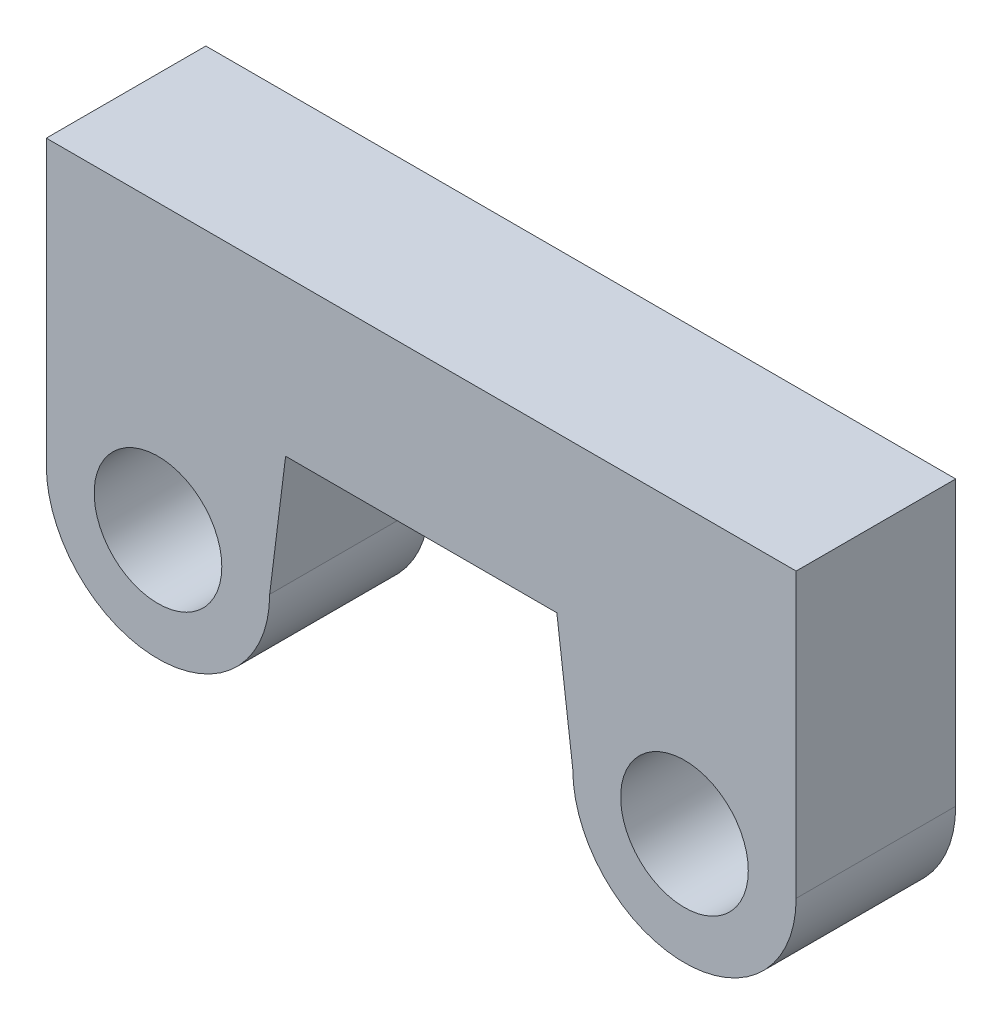
from build123d import *

# Parameters (mm, degrees)
ESBO_O1_R                = 4
RESSALTO_EXTRUS_O1_DEPTH = 10


with BuildPart() as part:
    # Esboço1 → Ressalto-extrusão1 (new body)
    with BuildSketch(Plane.XY):
        with BuildLine():
            Line((-23.5, 0), (-23.5, 17.766875201))
            Line((-23.5, 17.766875201), (23.5, 17.766875201))
            Line((23.5, 17.766875201), (23.5, 0))
            ThreePointArc((23.5, 0), (16.5, -7), (9.5, 0))
            Line((9.5, 0), (8.5, 8))
            Line((8.5, 8), (-8.5, 8))
            Line((-8.5, 8), (-9.5, 0))
            ThreePointArc((-9.5, 0), (-16.5, -7), (-23.5, 0))
        make_face()
        with Locations((-16.5, 0)):
            Circle(ESBO_O1_R, mode=Mode.SUBTRACT)
        with Locations((16.5, 0)):
            Circle(ESBO_O1_R, mode=Mode.SUBTRACT)
    extrude(amount=RESSALTO_EXTRUS_O1_DEPTH)


solid = part.part
